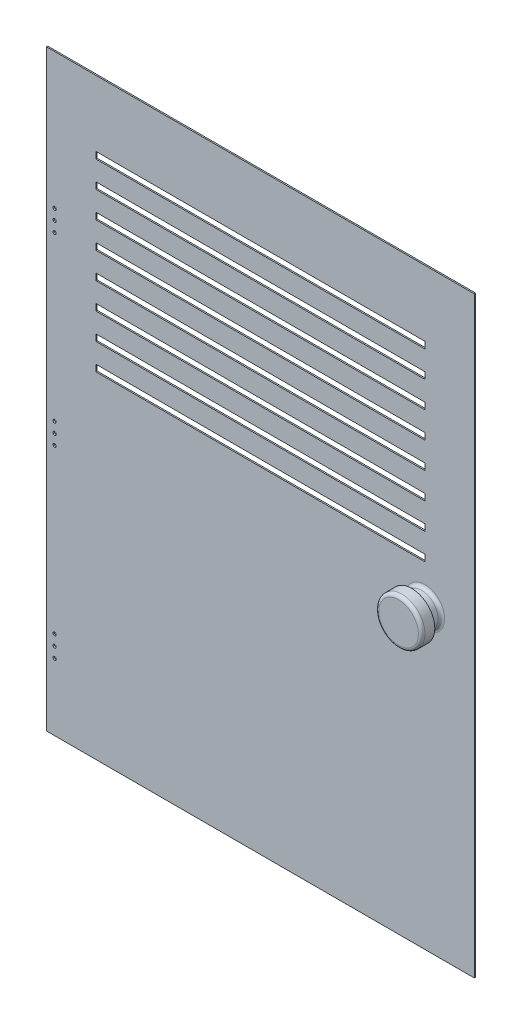
from build123d import *

# Parameters (mm, degrees)
ESQUISSE1_W               = 650
ESQUISSE1_H               = 900
T_LE_DE_BASE_PLI_E1_DEPTH = 2
ESQUISSE6_W               = 500
ESQUISSE6_H               = 10
ENL_V_MAT_EXTRU_1_DEPTH   = 10
ESQUISSE7_R               = 25
BOSS_EXTRU_1_DEPTH        = 20
ESQUISSE8_R               = 35
BOSS_EXTRU_2_DEPTH        = 20
CONG_1_R                  = 5
ESQUISSE9_R               = 2.5
ENL_V_MAT_EXTRU_2_DEPTH   = 20


# Sheet-metal steps are written as plain solids
with BuildPart() as part:
    # Esquisse1 → Tôle de base pliée1 (new body)
    with BuildSketch(Plane.XY):
        Rectangle(ESQUISSE1_W, ESQUISSE1_H)
    extrude(amount=-T_LE_DE_BASE_PLI_E1_DEPTH)

    # Esquisse6 → Enlèv. mat.-Extru.1 (cut)
    with BuildSketch(Plane.XY):
        with Locations((0, 345)):
            Rectangle(ESQUISSE6_W, ESQUISSE6_H)
        with Locations((0, 305)):
            Rectangle(ESQUISSE6_W, ESQUISSE6_H)
        with Locations((0, 265)):
            Rectangle(ESQUISSE6_W, ESQUISSE6_H)
        with Locations((0, 225)):
            Rectangle(ESQUISSE6_W, ESQUISSE6_H)
        with Locations((0, 185)):
            Rectangle(ESQUISSE6_W, ESQUISSE6_H)
        with Locations((0, 145)):
            Rectangle(ESQUISSE6_W, ESQUISSE6_H)
        with Locations((0, 105)):
            Rectangle(ESQUISSE6_W, ESQUISSE6_H)
        with Locations((0, 65)):
            Rectangle(ESQUISSE6_W, ESQUISSE6_H)
    extrude(amount=-ENL_V_MAT_EXTRU_1_DEPTH, mode=Mode.SUBTRACT)

    # Esquisse7 → Boss.-Extru.1 (add)
    with BuildSketch(Plane.XY):
        with Locations((250, 0)):
            Circle(ESQUISSE7_R)
    extrude(amount=BOSS_EXTRU_1_DEPTH)

    # Esquisse8 → Boss.-Extru.2 (add)
    with BuildSketch(Plane.XY.offset(20)):
        with Locations((250, 0)):
            Circle(ESQUISSE8_R)
    extrude(amount=BOSS_EXTRU_2_DEPTH)

    # Congé1
    cong_1_edges = [part.edges().sort_by_distance(p)[0] for p in [
        (225, 0, 0),
        (225, 0, 20),
        (215, 0, 40),
    ]]
    fillet(cong_1_edges, radius=CONG_1_R)

    # Esquisse9 → Enlèv. mat.-Extru.2 (cut)
    with BuildSketch(Plane.XY):
        with Locations((-312.5, 243.775317496)):
            Circle(ESQUISSE9_R)
        with Locations((-312.5, 227.775317496)):
            Circle(ESQUISSE9_R)
        with Locations((-312.5, 211.775317496)):
            Circle(ESQUISSE9_R)
        with Locations((-312.5, -36.224682504)):
            Circle(ESQUISSE9_R)
        with Locations((-312.5, -52.224682504)):
            Circle(ESQUISSE9_R)
        with Locations((-312.5, -68.224682504)):
            Circle(ESQUISSE9_R)
        with Locations((-312.5, -316.224682504)):
            Circle(ESQUISSE9_R)
        with Locations((-312.5, -332.224682504)):
            Circle(ESQUISSE9_R)
        with Locations((-312.5, -348.224682504)):
            Circle(ESQUISSE9_R)
    extrude(amount=-ENL_V_MAT_EXTRU_2_DEPTH, mode=Mode.SUBTRACT)


solid = part.part
